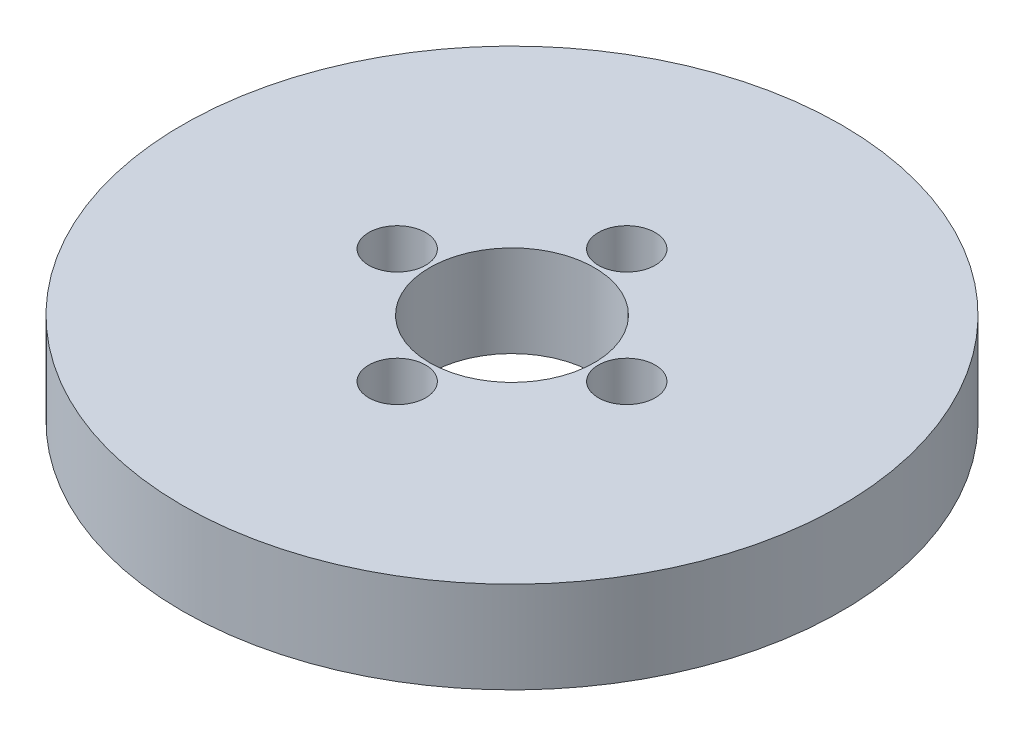
from build123d import *

# Parameters (mm, degrees)
SKETCH1_R           = 90
BOSS_EXTRUDE1_DEPTH = 25
SKETCH2_R           = 22.5
CUT_EXTRUDE1_DEPTH  = 130.711217711
SKETCH3_R           = 7.763970005
CUT_EXTRUDE2_DEPTH  = 23.390795668
CIRPATTERN1_COUNT   = 4


with BuildPart() as part:
    # Sketch1 → Boss-Extrude1 (new body)
    with BuildSketch(Plane(origin=(0, 0, 0), x_dir=(1, 0, 0), z_dir=(0, 1, 0))):
        Circle(SKETCH1_R)
    extrude(amount=BOSS_EXTRUDE1_DEPTH)

    # Sketch2 → Cut-Extrude1 (cut, through all)
    with BuildSketch(Plane(origin=(0, 0, 0), x_dir=(1, 0, 0), z_dir=(0, 1, 0))):
        Circle(SKETCH2_R)
    extrude(amount=CUT_EXTRUDE1_DEPTH, mode=Mode.SUBTRACT)

    # Sketch3 → Cut-Extrude2 (cut)
    with BuildSketch(Plane(origin=(0, 25, 0), x_dir=(1, 0, 0), z_dir=(0, 1, 0))):
        with Locations((-31.344140601, 0)):
            Circle(SKETCH3_R)
    cut_extrude2 = extrude(amount=-CUT_EXTRUDE2_DEPTH, mode=Mode.SUBTRACT)

    # CirPattern1: Cut-Extrude2 ×4 about axis
    cirpattern1_axis = Axis((0, 0, 0), (0, 1, 0))
    for i in range(1, CIRPATTERN1_COUNT):
        add(cut_extrude2.rotate(cirpattern1_axis, i * 360 / CIRPATTERN1_COUNT), mode=Mode.SUBTRACT)


solid = part.part
